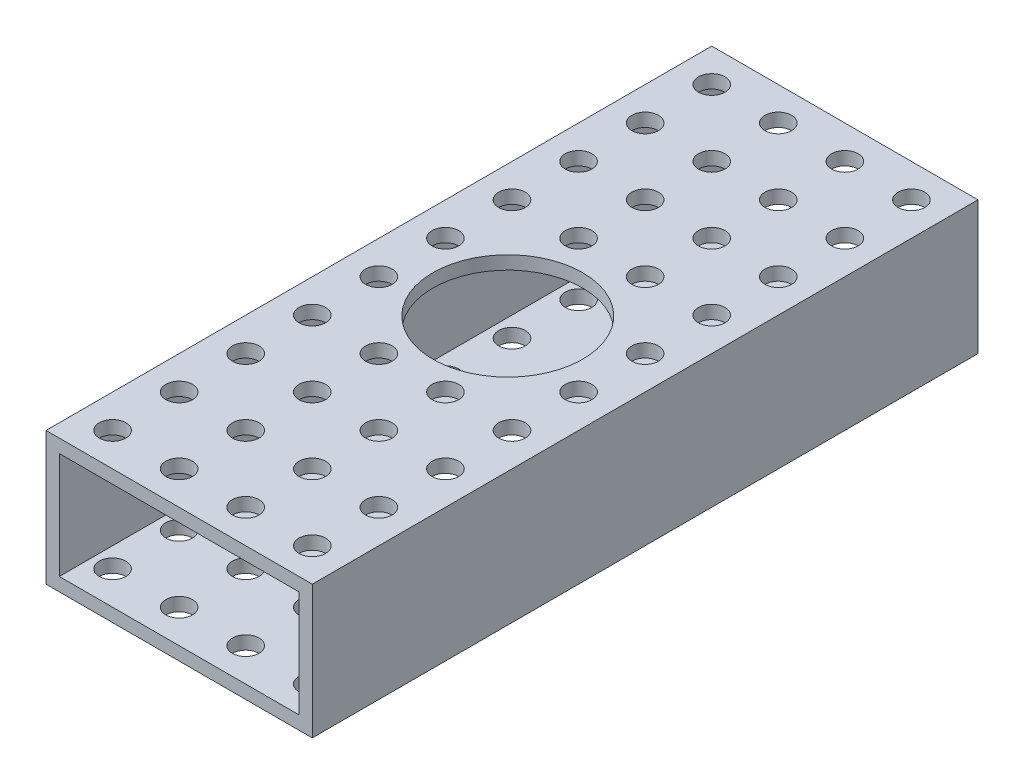
from build123d import *

# Parameters (mm, degrees)
SKETCH1_W           = 50.8
SKETCH1_H           = 25.4
SKETCH1_W_2         = 45.72
SKETCH1_H_2         = 20.32
BOSS_EXTRUDE1_DEPTH = 127
SKETCH2_R           = 2.54
CUT_EXTRUDE1_DEPTH  = 25.4
SKETCH3_R           = 14.3002
CUT_EXTRUDE2_DEPTH  = 25.4


with BuildPart() as part:
    # Sketch1 → Boss-Extrude1 (new body)
    with BuildSketch(Plane.XY):
        with Locations((-75.184, 73.640461538)):
            Rectangle(SKETCH1_W, SKETCH1_H)
        with Locations((-75.184, 73.640461538)):
            Rectangle(SKETCH1_W_2, SKETCH1_H_2, mode=Mode.SUBTRACT)
    extrude(amount=BOSS_EXTRUDE1_DEPTH)

    # Sketch2 → Cut-Extrude1 (cut)
    with BuildSketch(Plane(origin=(0, 86.340461538, 0), x_dir=(1, 0, 0), z_dir=(0, 1, 0))):
        with Locations((-94.234, -6.35)):
            Circle(SKETCH2_R)
        with Locations((-81.534, -6.35)):
            Circle(SKETCH2_R)
        with Locations((-68.834, -6.35)):
            Circle(SKETCH2_R)
        with Locations((-56.134, -6.35)):
            Circle(SKETCH2_R)
        with Locations((-81.534, -19.05)):
            Circle(SKETCH2_R)
        with Locations((-68.834, -19.05)):
            Circle(SKETCH2_R)
        with Locations((-56.134, -19.05)):
            Circle(SKETCH2_R)
        with Locations((-81.534, -31.75)):
            Circle(SKETCH2_R)
        with Locations((-68.834, -31.75)):
            Circle(SKETCH2_R)
        with Locations((-56.134, -31.75)):
            Circle(SKETCH2_R)
        with Locations((-81.534, -44.45)):
            Circle(SKETCH2_R)
        with Locations((-68.834, -44.45)):
            Circle(SKETCH2_R)
        with Locations((-56.134, -44.45)):
            Circle(SKETCH2_R)
        with Locations((-81.534, -57.15)):
            Circle(SKETCH2_R)
        with Locations((-68.834, -57.15)):
            Circle(SKETCH2_R)
        with Locations((-56.134, -57.15)):
            Circle(SKETCH2_R)
        with Locations((-81.534, -69.85)):
            Circle(SKETCH2_R)
        with Locations((-68.834, -69.85)):
            Circle(SKETCH2_R)
        with Locations((-56.134, -69.85)):
            Circle(SKETCH2_R)
        with Locations((-81.534, -82.55)):
            Circle(SKETCH2_R)
        with Locations((-68.834, -82.55)):
            Circle(SKETCH2_R)
        with Locations((-56.134, -82.55)):
            Circle(SKETCH2_R)
        with Locations((-81.534, -95.25)):
            Circle(SKETCH2_R)
        with Locations((-68.834, -95.25)):
            Circle(SKETCH2_R)
        with Locations((-56.134, -95.25)):
            Circle(SKETCH2_R)
        with Locations((-81.534, -107.95)):
            Circle(SKETCH2_R)
        with Locations((-68.834, -107.95)):
            Circle(SKETCH2_R)
        with Locations((-56.134, -107.95)):
            Circle(SKETCH2_R)
        with Locations((-81.534, -120.65)):
            Circle(SKETCH2_R)
        with Locations((-68.834, -120.65)):
            Circle(SKETCH2_R)
        with Locations((-56.134, -120.65)):
            Circle(SKETCH2_R)
        with Locations((-94.234, -19.05)):
            Circle(SKETCH2_R)
        with Locations((-94.234, -31.75)):
            Circle(SKETCH2_R)
        with Locations((-94.234, -44.45)):
            Circle(SKETCH2_R)
        with Locations((-94.234, -57.15)):
            Circle(SKETCH2_R)
        with Locations((-94.234, -69.85)):
            Circle(SKETCH2_R)
        with Locations((-94.234, -82.55)):
            Circle(SKETCH2_R)
        with Locations((-94.234, -95.25)):
            Circle(SKETCH2_R)
        with Locations((-94.234, -107.95)):
            Circle(SKETCH2_R)
        with Locations((-94.234, -120.65)):
            Circle(SKETCH2_R)
    extrude(amount=-CUT_EXTRUDE1_DEPTH, mode=Mode.SUBTRACT)

    # Sketch3 → Cut-Extrude2 (cut)
    with BuildSketch(Plane.XZ.offset(-60.940461538)):
        with Locations((-75.450612599, 64.036338499)):
            Circle(SKETCH3_R)
    extrude(amount=-CUT_EXTRUDE2_DEPTH, mode=Mode.SUBTRACT)


solid = part.part
